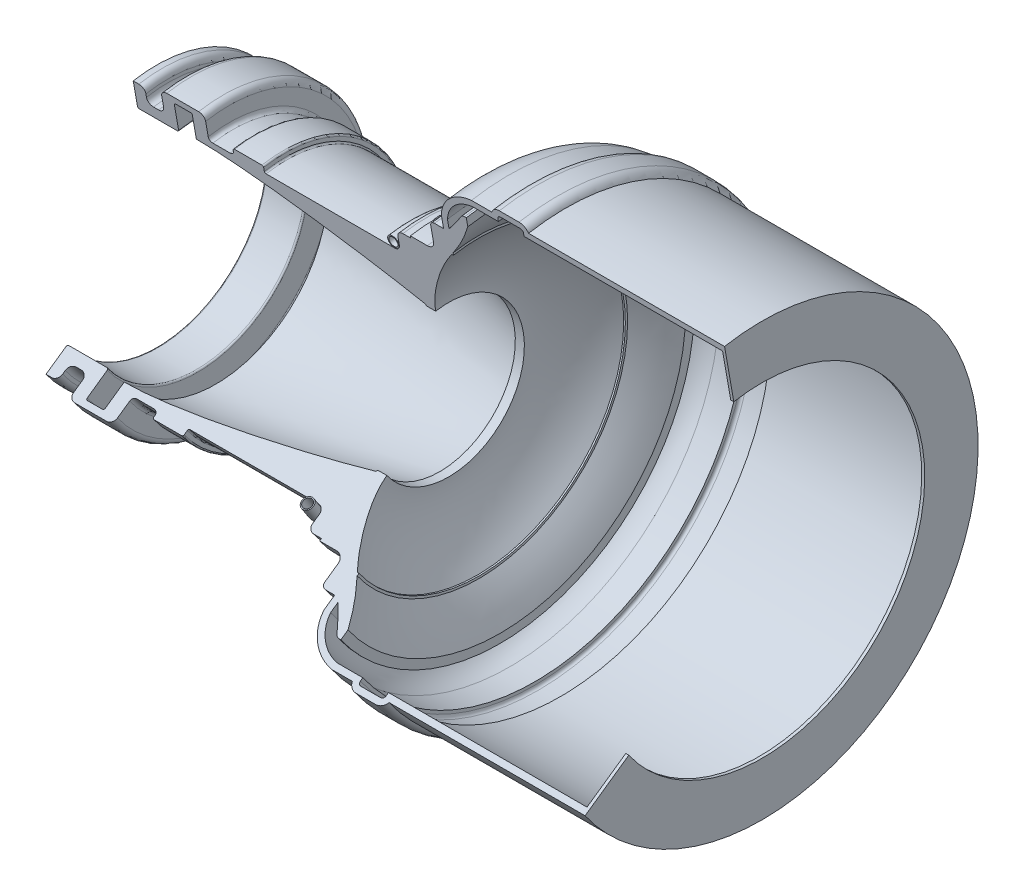
from build123d import *

# Parameters (mm, degrees)
REVOLVE1_ANGLE           = 100.00000000000021
REVOLVE1_OTHER_WAY_ANGLE = 145.0000000000003
REVOLVE2_ANGLE           = 235.00000000000054
REVOLVE2_OTHER_WAY_ANGLE = 10.000000000000021
REVOLVE3_ANGLE           = 10.000000000000021
REVOLVE3_OTHER_WAY_ANGLE = 235.00000000000054
REVOLVE4_OUTLINE_R       = 1.86
REVOLVE4_OUTLINE_R_2     = 1.5
REVOLVE4_ANGLE           = 250
BOSS_EXTRUDE1_DEPTH      = 2
FILLET1_R                = 0.5
CIRPATTERN2_COUNT        = 16
CIRPATTERN2_ANGLE        = 230.00000000000054
FILLET1_OF_CIRPATTERN2_R = 0.5


# Read off the part's stored shape, not the designer's step: Revolve4
with BuildPart() as part:
    # Sketch1 → Revolve1 (revolve)
    with BuildSketch(Plane(origin=(0, 0, 0), x_dir=(1, 0, 0), z_dir=(0, 1, 0))):
        with BuildLine():
            Line((20.819999999999997, 1.8200000000000005), (20.819999999999997, 22.199999999999996))
            Line((20.819999999999997, 22.199999999999996), (14.720000000000011, 22.199999999999996))
            ThreePointArc((14.720000000000011, 22.199999999999996), (13.305786437626903, 21.61421356237309), (12.719999999999999, 20.19999999999998))
            Line((12.719999999999999, 20.19999999999998), (12.719999999999997, 17.400000000000006))
            ThreePointArc((12.719999999999997, 17.400000000000006), (12.134213562373093, 15.985786437626896), (10.719999999999983, 15.399999999999993))
            Line((10.719999999999983, 15.399999999999993), (-31.78, 15.399999999999988))
            ThreePointArc((-31.78, 15.399999999999988), (-32.13355339059328, 15.546446609406715), (-32.28, 15.89999999999999))
            Line((-32.28, 15.89999999999999), (-32.28, 17.139999999999986))
            ThreePointArc((-32.28, 17.139999999999986), (-32.426446609406725, 17.493553390593263), (-32.78, 17.63999999999999))
            Line((-32.78, 17.63999999999999), (-41.88, 17.63999999999999))
            ThreePointArc((-41.88, 17.63999999999999), (-42.23355339059328, 17.493553390593263), (-42.38, 17.139999999999986))
            Line((-42.38, 17.139999999999986), (-42.38, 16.699999999999996))
            ThreePointArc((-42.38, 16.699999999999996), (-42.76076118445749, 15.780761184457473), (-43.680000000000014, 15.399999999999988))
            Line((-43.680000000000014, 15.399999999999988), (-49.419999999999995, 15.399999999999988))
            ThreePointArc((-49.419999999999995, 15.399999999999988), (-50.339238815542515, 15.780761184457477), (-50.72, 16.699999999999996))
            Line((-50.72, 16.699999999999996), (-50.72, 21.609999999999975))
            ThreePointArc((-50.72, 21.609999999999975), (-51.30578643762691, 23.024213562373088), (-52.72000000000002, 23.60999999999999))
            Line((-52.72000000000002, 23.60999999999999), (-63.26999999999998, 23.609999999999985))
            ThreePointArc((-63.26999999999998, 23.609999999999985), (-64.68421356237309, 23.02421356237308), (-65.27, 21.60999999999997))
            Line((-65.27, 21.60999999999997), (-65.27, 18.05))
            ThreePointArc((-65.27, 18.05), (-65.8557864376269, 16.63578643762689), (-67.27000000000001, 16.049999999999983))
            Line((-67.27000000000001, 16.049999999999983), (-68.94999999999999, 16.049999999999983))
            ThreePointArc((-68.94999999999999, 16.049999999999983), (-70.3642135623731, 16.635786437626887), (-70.95, 18.049999999999997))
            Line((-70.95, 18.049999999999997), (-70.95, 19.12999999999997))
            ThreePointArc((-70.95, 19.12999999999997), (-71.53578643762691, 20.54421356237308), (-72.95000000000002, 21.12999999999998))
            Line((-72.95000000000002, 21.12999999999998), (-74.81, 21.12999999999998))
            Line((-74.81, 21.12999999999998), (-74.81, 12.989999999999986))
            ThreePointArc((-74.81, 12.989999999999986), (-74.66355339059328, 12.63644660940671), (-74.31, 12.489999999999982))
            Line((-74.31, 12.489999999999982), (-61.67, 12.489999999999982))
            ThreePointArc((-61.67, 12.489999999999982), (-61.316446609406725, 12.63644660940671), (-61.17, 12.989999999999986))
            Line((-61.17, 12.989999999999986), (-61.17, 21.129999999999978))
            ThreePointArc((-61.17, 21.129999999999978), (-61.02355339059328, 21.483553390593254), (-60.67, 21.62999999999998))
            Line((-60.67, 21.62999999999998), (-55.71, 21.62999999999998))
            ThreePointArc((-55.71, 21.62999999999998), (-55.356446609406724, 21.483553390593254), (-55.21, 21.129999999999978))
            Line((-55.21, 21.129999999999978), (-55.21, 13.439999999999984))
            add(Edge.make_bspline(
                [(18.959999999999997, 1.8199999999999987), (0.2192284620746005, 6.529001303291011), (-36.5933333333334, 13.439999999999987), (-55.21, 13.439999999999984)],
                knots=[0, 0, 0, 0, 1, 1, 1, 1], degree=3))
            Line((18.959999999999997, 1.8199999999999987), (20.819999999999997, 1.8200000000000005))
        make_face()
    revolve(axis=Axis((-81.85554964444076, 0, 23.61), (1, 0, 0)), revolution_arc=REVOLVE1_ANGLE)

    # Sketch1 → Revolve1 other way (revolve)
    with BuildSketch(Plane(origin=(0, 0, 0), x_dir=(1, 0, 0), z_dir=(0, 1, 0))):
        with BuildLine():
            Line((20.819999999999997, 1.8200000000000005), (20.819999999999997, 22.199999999999996))
            Line((20.819999999999997, 22.199999999999996), (14.720000000000011, 22.199999999999996))
            ThreePointArc((14.720000000000011, 22.199999999999996), (13.305786437626903, 21.61421356237309), (12.719999999999999, 20.19999999999998))
            Line((12.719999999999999, 20.19999999999998), (12.719999999999997, 17.400000000000006))
            ThreePointArc((12.719999999999997, 17.400000000000006), (12.134213562373093, 15.985786437626896), (10.719999999999983, 15.399999999999993))
            Line((10.719999999999983, 15.399999999999993), (-31.78, 15.399999999999988))
            ThreePointArc((-31.78, 15.399999999999988), (-32.13355339059328, 15.546446609406715), (-32.28, 15.89999999999999))
            Line((-32.28, 15.89999999999999), (-32.28, 17.139999999999986))
            ThreePointArc((-32.28, 17.139999999999986), (-32.426446609406725, 17.493553390593263), (-32.78, 17.63999999999999))
            Line((-32.78, 17.63999999999999), (-41.88, 17.63999999999999))
            ThreePointArc((-41.88, 17.63999999999999), (-42.23355339059328, 17.493553390593263), (-42.38, 17.139999999999986))
            Line((-42.38, 17.139999999999986), (-42.38, 16.699999999999996))
            ThreePointArc((-42.38, 16.699999999999996), (-42.76076118445749, 15.780761184457473), (-43.680000000000014, 15.399999999999988))
            Line((-43.680000000000014, 15.399999999999988), (-49.419999999999995, 15.399999999999988))
            ThreePointArc((-49.419999999999995, 15.399999999999988), (-50.339238815542515, 15.780761184457477), (-50.72, 16.699999999999996))
            Line((-50.72, 16.699999999999996), (-50.72, 21.609999999999975))
            ThreePointArc((-50.72, 21.609999999999975), (-51.30578643762691, 23.024213562373088), (-52.72000000000002, 23.60999999999999))
            Line((-52.72000000000002, 23.60999999999999), (-63.26999999999998, 23.609999999999985))
            ThreePointArc((-63.26999999999998, 23.609999999999985), (-64.68421356237309, 23.02421356237308), (-65.27, 21.60999999999997))
            Line((-65.27, 21.60999999999997), (-65.27, 18.05))
            ThreePointArc((-65.27, 18.05), (-65.8557864376269, 16.63578643762689), (-67.27000000000001, 16.049999999999983))
            Line((-67.27000000000001, 16.049999999999983), (-68.94999999999999, 16.049999999999983))
            ThreePointArc((-68.94999999999999, 16.049999999999983), (-70.3642135623731, 16.635786437626887), (-70.95, 18.049999999999997))
            Line((-70.95, 18.049999999999997), (-70.95, 19.12999999999997))
            ThreePointArc((-70.95, 19.12999999999997), (-71.53578643762691, 20.54421356237308), (-72.95000000000002, 21.12999999999998))
            Line((-72.95000000000002, 21.12999999999998), (-74.81, 21.12999999999998))
            Line((-74.81, 21.12999999999998), (-74.81, 12.989999999999986))
            ThreePointArc((-74.81, 12.989999999999986), (-74.66355339059328, 12.63644660940671), (-74.31, 12.489999999999982))
            Line((-74.31, 12.489999999999982), (-61.67, 12.489999999999982))
            ThreePointArc((-61.67, 12.489999999999982), (-61.316446609406725, 12.63644660940671), (-61.17, 12.989999999999986))
            Line((-61.17, 12.989999999999986), (-61.17, 21.129999999999978))
            ThreePointArc((-61.17, 21.129999999999978), (-61.02355339059328, 21.483553390593254), (-60.67, 21.62999999999998))
            Line((-60.67, 21.62999999999998), (-55.71, 21.62999999999998))
            ThreePointArc((-55.71, 21.62999999999998), (-55.356446609406724, 21.483553390593254), (-55.21, 21.129999999999978))
            Line((-55.21, 21.129999999999978), (-55.21, 13.439999999999984))
            add(Edge.make_bspline(
                [(18.959999999999997, 1.8199999999999987), (0.2192284620746005, 6.529001303291011), (-36.5933333333334, 13.439999999999987), (-55.21, 13.439999999999984)],
                knots=[0, 0, 0, 0, 1, 1, 1, 1], degree=3))
            Line((18.959999999999997, 1.8199999999999987), (20.819999999999997, 1.8200000000000005))
        make_face()
    revolve(axis=Axis((-81.85554964444076, 0, 23.61), (-1, 0, 0)), revolution_arc=REVOLVE1_OTHER_WAY_ANGLE)

    # Sketch6 → Revolve2 (revolve)
    with BuildSketch(Plane.XY.offset(23.61)):
        with BuildLine():
            Line((21.96, 25.04366115910043), (18.96, 25.04366115910043))
            Line((18.96, 25.04366115910043), (17.302934675950663, 28.295834972387976))
            Line((17.302934675950663, 28.295834972387976), (17.302934675950667, 46.52583471304439))
            Line((17.302934675950667, 46.52583471304439), (22.932934523411976, 46.52583471304439))
            ThreePointArc((22.932934523411976, 46.52583471304439), (24.70070147637834, 47.25806776007802), (25.432934523411973, 49.02583471304439))
            Line((25.432934523411973, 49.02583471304439), (25.432934523411973, 54.39583471304439))
            ThreePointArc((25.432934523411973, 54.39583471304439), (25.872274351632154, 55.45649488482421), (26.932934523411976, 55.89583471304439))
            Line((26.932934523411976, 55.89583471304439), (29.432934523411973, 55.89583471304439))
            add(Edge.make_bspline(
                [(29.432934523411973, 55.89583471304439), (31.666267856745318, 55.89583471304439), (34.103147145509276, 59.98879442341514), (36.24592726134377, 62.32337660056277), (37.05996232845516, 63.650236811973734)],
                knots=[0, 0, 0, 0, 0.5723179017660327, 0.930416882946525, 0.930416882946525, 0.930416882946525, 0.930416882946525], degree=3))
            ThreePointArc((37.05996232845516, 63.650236811973734), (37.605924376777864, 64.17476617580208), (38.33852141867947, 64.36583471304438))
            Line((38.33852141867947, 64.36583471304438), (38.932934523411966, 64.36583471304438))
            Line((38.932934523411966, 64.36583471304438), (38.93293452341197, 61.46583471304439))
            add(Edge.make_bspline(
                [(38.93293452341197, 61.46583471304439), (35.1803646122963, 52.64413437580968), (28.54263893787043, 46.69825995929512), (21.960000000000004, 31.193661159100422), (21.96, 25.04366115910043)],
                knots=[0, 0, 0, 0, 0.468719812917794, 1, 1, 1, 1], degree=3))
        make_face()
    revolve(axis=Axis((0, 0, 23.61), (-1, 0, 0)), revolution_arc=REVOLVE2_ANGLE)

    # Sketch6 → Revolve2 other way (revolve)
    with BuildSketch(Plane.XY.offset(23.61)):
        with BuildLine():
            Line((21.96, 25.04366115910043), (18.96, 25.04366115910043))
            Line((18.96, 25.04366115910043), (17.302934675950663, 28.295834972387976))
            Line((17.302934675950663, 28.295834972387976), (17.302934675950667, 46.52583471304439))
            Line((17.302934675950667, 46.52583471304439), (22.932934523411976, 46.52583471304439))
            ThreePointArc((22.932934523411976, 46.52583471304439), (24.70070147637834, 47.25806776007802), (25.432934523411973, 49.02583471304439))
            Line((25.432934523411973, 49.02583471304439), (25.432934523411973, 54.39583471304439))
            ThreePointArc((25.432934523411973, 54.39583471304439), (25.872274351632154, 55.45649488482421), (26.932934523411976, 55.89583471304439))
            Line((26.932934523411976, 55.89583471304439), (29.432934523411973, 55.89583471304439))
            add(Edge.make_bspline(
                [(29.432934523411973, 55.89583471304439), (31.666267856745318, 55.89583471304439), (34.103147145509276, 59.98879442341514), (36.24592726134377, 62.32337660056277), (37.05996232845516, 63.650236811973734)],
                knots=[0, 0, 0, 0, 0.5723179017660327, 0.930416882946525, 0.930416882946525, 0.930416882946525, 0.930416882946525], degree=3))
            ThreePointArc((37.05996232845516, 63.650236811973734), (37.605924376777864, 64.17476617580208), (38.33852141867947, 64.36583471304438))
            Line((38.33852141867947, 64.36583471304438), (38.932934523411966, 64.36583471304438))
            Line((38.932934523411966, 64.36583471304438), (38.93293452341197, 61.46583471304439))
            add(Edge.make_bspline(
                [(38.93293452341197, 61.46583471304439), (35.1803646122963, 52.64413437580968), (28.54263893787043, 46.69825995929512), (21.960000000000004, 31.193661159100422), (21.96, 25.04366115910043)],
                knots=[0, 0, 0, 0, 0.468719812917794, 1, 1, 1, 1], degree=3))
        make_face()
    revolve(axis=Axis((0, 0, 23.61), (1, 0, 0)), revolution_arc=REVOLVE2_OTHER_WAY_ANGLE)

    # Sketch9 → Revolve3 (revolve)
    with BuildSketch(Plane.XY.offset(23.61)):
        with BuildLine():
            Line((31.944174248302648, 48.5), (31.944174248302648, 60))
            ThreePointArc((31.944174248302648, 60), (35.46409174701751, 66.38963205418065), (42.03417424830265, 69.56))
            Line((42.03417424830265, 69.56), (50.47417424830265, 69.56))
            Line((50.47417424830265, 69.56), (50.47417424830265, 70.56000000000002))
            ThreePointArc((50.47417424830265, 70.56000000000002), (50.76706746711611, 71.26710678118657), (51.47417424830265, 71.56000000000002))
            Line((51.47417424830265, 71.56000000000002), (57.97417424830265, 71.56000000000002))
            ThreePointArc((57.97417424830265, 71.56000000000002), (58.6812810294892, 71.26710678118657), (58.974174248302646, 70.56000000000002))
            Line((58.974174248302646, 70.56000000000002), (58.97417424830266, 69.56))
            Line((58.97417424830266, 69.56), (124.72417424830266, 69.56))
            Line((124.72417424830266, 69.56), (124.72417424830263, 53.88999999999999))
            Line((124.72417424830263, 53.88999999999999), (125.72417424830262, 53.89))
            Line((125.72417424830262, 53.89), (125.72417424830262, 71.56))
            Line((125.72417424830262, 71.56), (60.802601373048844, 71.56))
            ThreePointArc((60.802601373048844, 71.56), (59.706225055871535, 73.00948974278319), (57.97417424830265, 73.56000000000002))
            Line((57.97417424830265, 73.56000000000002), (51.47417424830265, 73.56000000000002))
            ThreePointArc((51.47417424830265, 73.56000000000002), (49.74212344073377, 73.00948974278319), (48.64574712355646, 71.56))
            Line((48.64574712355646, 71.56), (41.89865471715389, 71.56))
            ThreePointArc((41.89865471715389, 71.56), (34.068084474765875, 67.82205812783253), (29.944174248302645, 60.187701298030326))
            Line((29.944174248302645, 60.187701298030326), (29.944174248302645, 48.5))
            Line((29.944174248302645, 48.5), (31.944174248302648, 48.5))
        make_face()
    revolve(axis=Axis((0, 0, 23.61), (1, 0, 0)), revolution_arc=REVOLVE3_ANGLE)

    # Sketch9 → Revolve3 other way (revolve)
    with BuildSketch(Plane.XY.offset(23.61)):
        with BuildLine():
            Line((31.944174248302648, 48.5), (31.944174248302648, 60))
            ThreePointArc((31.944174248302648, 60), (35.46409174701751, 66.38963205418065), (42.03417424830265, 69.56))
            Line((42.03417424830265, 69.56), (50.47417424830265, 69.56))
            Line((50.47417424830265, 69.56), (50.47417424830265, 70.56000000000002))
            ThreePointArc((50.47417424830265, 70.56000000000002), (50.76706746711611, 71.26710678118657), (51.47417424830265, 71.56000000000002))
            Line((51.47417424830265, 71.56000000000002), (57.97417424830265, 71.56000000000002))
            ThreePointArc((57.97417424830265, 71.56000000000002), (58.6812810294892, 71.26710678118657), (58.974174248302646, 70.56000000000002))
            Line((58.974174248302646, 70.56000000000002), (58.97417424830266, 69.56))
            Line((58.97417424830266, 69.56), (124.72417424830266, 69.56))
            Line((124.72417424830266, 69.56), (124.72417424830263, 53.88999999999999))
            Line((124.72417424830263, 53.88999999999999), (125.72417424830262, 53.89))
            Line((125.72417424830262, 53.89), (125.72417424830262, 71.56))
            Line((125.72417424830262, 71.56), (60.802601373048844, 71.56))
            ThreePointArc((60.802601373048844, 71.56), (59.706225055871535, 73.00948974278319), (57.97417424830265, 73.56000000000002))
            Line((57.97417424830265, 73.56000000000002), (51.47417424830265, 73.56000000000002))
            ThreePointArc((51.47417424830265, 73.56000000000002), (49.74212344073377, 73.00948974278319), (48.64574712355646, 71.56))
            Line((48.64574712355646, 71.56), (41.89865471715389, 71.56))
            ThreePointArc((41.89865471715389, 71.56), (34.068084474765875, 67.82205812783253), (29.944174248302645, 60.187701298030326))
            Line((29.944174248302645, 60.187701298030326), (29.944174248302645, 48.5))
            Line((29.944174248302645, 48.5), (31.944174248302648, 48.5))
        make_face()
    revolve(axis=Axis((0, 0, 23.61), (-1, 0, 0)), revolution_arc=REVOLVE3_OTHER_WAY_ANGLE)

    # Sketch14 → Boss-Extrude1 (add)
    with BuildSketch(Plane.ZY.offset(-25.432934523411976)):
        with BuildLine():
            Line((29.853725294066894, 49.58058335980471), (31.053068326126613, 51.172367158577714))
            ThreePointArc((31.053068326125697, 51.17236715857906), (29.089664429820402, 51.419682072688445), (27.11823550090517, 51.59169226135138))
            Line((27.118235500905097, 51.59169226135132), (27.868618139340267, 49.82420106083059))
            Line((27.868618139340267, 49.82420106083059), (29.853725294066894, 49.58058335980471))
        make_face()
        with BuildLine():
            Line((31.053068326126613, 51.172367158577714), (31.057257989330186, 51.17792773451929))
            Line((31.057257989330186, 51.17792773451929), (30.275683529866846, 53.018889810259736))
            Line((30.275683529866846, 53.018889810259736), (28.290576375140216, 53.26250751128561))
            Line((28.290576375140216, 53.26250751128561), (27.08704367987692, 51.665163136571046))
            Line((27.08704367987692, 51.665163136571046), (27.118235500905097, 51.59169226135132))
            ThreePointArc((27.11823550090517, 51.59169226135138), (29.089664429820402, 51.419682072688445), (31.053068326125697, 51.17236715857906))
        make_face()
    boss_extrude1 = extrude(amount=BOSS_EXTRUDE1_DEPTH)

    # Fillet1
    fillet1_edges = [part.edges().sort_by_distance(p)[0] for p in [
        (23.432934523411976, 50.379255547162, 30.45549164169854),
        (23.432934523411976, 52.09840877238951, 30.666470759598518),
        (23.432934523411976, 53.14069866077267, 29.28312995250353),
        (23.432934523411976, 52.46383532392833, 27.688810027508566),
        (23.432934523411976, 50.74468209870082, 27.477830909608592),
        (23.432934523411976, 49.702392210317655, 28.86117171670358),
    ]]
    fillet(fillet1_edges, radius=FILLET1_R)

    # CirPattern2: Boss-Extrude1 ×16 about axis
    cirpattern2_axis = Axis((0, -1.51e-15, 23.609999999999996), (-1, 0, 0))
    for i in range(1, CIRPATTERN2_COUNT):
        add(boss_extrude1.rotate(cirpattern2_axis, i * CIRPATTERN2_ANGLE / (CIRPATTERN2_COUNT - 1)))

    # Fillet1 of CirPattern2
    fillet1_of_cirpattern2_edges = [part.edges().sort_by_distance(p)[0] for p in [
        (23.432934523411976, 50.39612431989454, 16.889821517507738),
        (23.432934523411976, 52.10987220638384, 16.638687725370033),
        (23.432934523411976, 52.749257905888506, 15.02897162391956),
        (23.432934523411976, 51.67489571890389, 13.670389314606787),
        (23.432934523411976, 49.96114783241459, 13.921523106744491),
        (23.432934523411976, 49.32176213290991, 15.531239208194968),
        (23.432934523411976, 46.825166015645436, 3.8025778327905186),
        (23.432934523411976, 48.41150253310663, 3.1072099780768454),
        (23.432934523411976, 48.60246456468009, 1.3857183276476803),
        (23.432934523411976, 47.20709007879236, 0.3595945319321885),
        (23.432934523411976, 45.62075356133118, 1.0549623866458617),
        (23.432934523411976, 45.42979152975771, 2.7764540370750304),
        (23.432934523411976, 39.92060615408823, -7.874525557692479),
        (23.432934523411976, 41.266596008639894, -8.96462248523791),
        (23.432934523411976, 40.99553930407401, -10.67533235628849),
        (23.432934523411976, 39.37849274495647, -11.295945299793637),
        (23.432934523411976, 38.03250289040481, -10.205848372248202),
        (23.432934523411976, 38.303559594970686, -8.495138501197616),
        (23.432934523411976, 30.173997749670825, -17.310166239956537),
        (23.432934523411976, 31.1838165319824, -18.717385493268097),
        (23.432934523411976, 30.470038301075803, -20.29552383862437),
        (23.432934523411976, 28.746441287857635, -20.466442930669082),
        (23.432934523411976, 27.736622505546052, -19.059223677357522),
        (23.432934523411976, 28.45040073645265, -17.481085332001243),
        (23.432934523411976, 18.279226413916355, -23.832597178185782),
        (23.432934523411976, 18.8809825803639, -25.4567552727512),
        (23.432934523411976, 17.775298493931885, -26.789970447061403),
        (23.432934523411976, 16.067858241052335, -26.499027526806206),
        (23.432934523411976, 15.466102074604798, -24.87486943224079),
        (23.432934523411976, 16.571786161036812, -23.541654257930578),
        (23.432934523411976, 5.0831108903065925, -26.977470078861085),
        (23.432934523411976, 5.233963903113484, -28.702939107423195),
        (23.432934523411976, 3.815090397338878, -29.696316163032424),
        (23.432934523411976, 2.2453638787573844, -28.964224190079566),
        (23.432934523411976, 2.0945108659504967, -27.23875516151745),
        (23.432934523411976, 3.5133843717251025, -26.245378105908205),
        (23.432934523411976, -8.47488410585504, -26.520893515826586),
        (23.432934523411976, -8.785673852785438, -28.22483299045676),
        (23.432934523411976, -10.416723597791474, -28.807650911694374),
        (23.432934523411976, -11.736983595867114, -27.686529358301826),
        (23.432934523411976, -11.426193848936713, -25.982589883671665),
        (23.432934523411976, -9.795144103930674, -25.399771962434038),
        (23.432934523411973, -21.429530747761103, -22.495372325072708),
        (23.432934523411973, -22.17983734922609, -24.056474501036227),
        (23.432934523411973, -23.90694479224617, -24.18724101152214),
        (23.432934523411973, -24.883745633801247, -22.75690534604452),
        (23.432934523411973, -24.133439032336256, -21.195803170081),
        (23.432934523411973, -22.40633158931618, -21.065036659595087),
        (23.432934523411976, -32.858555098242725, -15.187493503557235),
        (23.432934523411976, -33.99496233668386, -16.494619583328657),
        (23.432934523411976, -35.69517034693564, -16.16402508567981),
        (23.432934523411976, -36.258971118746274, -14.526304508259557),
        (23.432934523411976, -35.122563880305144, -13.219178428488142),
        (23.432934523411976, -33.422355870053366, -13.549772926136981),
        (23.432934523411976, -41.94829611527504, -5.117523358758561),
        (23.432934523411976, -43.38990029590269, -6.077615743061699),
        (23.432934523411976, -44.942166781002996, -5.309196092587868),
        (23.432934523411976, -45.052829085475665, -3.580684057810899),
        (23.432934523411976, -43.61122490484803, -2.620591673507775),
        (23.432934523411976, -42.058958419747704, -3.3890113239815918),
        (23.432934523411976, -48.051632231797704, 6.997631560705173),
        (23.432934523411976, -49.69580192048185, 6.452924267920956),
        (23.432934523411976, -50.98961711800169, 7.60446334006167),
        (23.432934523411976, -50.63926262683739, 9.300709704986595),
        (23.432934523411976, -48.995092938153256, 9.845416997770805),
        (23.432934523411976, -47.70127774063341, 8.693877925630098),
        (23.432934523411976, -50.734051570671454, 20.29546284871198),
        (23.432934523411976, -52.46373418434499, 20.204919732157162),
        (23.432934523411976, -53.406988130256046, 21.657597257805307),
        (23.432934523411976, -52.62055946249357, 23.20081790000827),
        (23.432934523411976, -50.89087684882003, 23.29136101656309),
        (23.432934523411976, -49.94762290290897, 21.838683490914946),
        (23.432934523411976, -49.80458594008175, 33.829264388390655),
        (23.432934523411976, -51.496641015074715, 34.19933144068061),
        (23.432934523411976, -52.02218108418446, 35.84972764637187),
        (23.432934523411976, -50.85566607830126, 37.13005679977318),
        (23.432934523411976, -49.163611003308304, 36.75998974748323),
        (23.432934523411976, -48.63807093419855, 35.109593541791966),
        (23.432934523411976, -45.32940634031003, 46.63553074606271),
        (23.432934523411976, -46.86337221224383, 47.439861961261016),
        (23.432934523411976, -46.933783882792184, 49.170480982493174),
        (23.432934523411976, -45.47022968140675, 50.09676878852706),
        (23.432934523411976, -43.93626380947295, 49.292437573328755),
        (23.432934523411976, -43.865852138924595, 47.56181855209658),
        (23.432934523411976, -37.627112083487845, 57.802551550878164),
        (23.432934523411976, -38.893781856698155, 58.98388456304507),
        (23.432934523411976, -38.504052344437554, 60.671519270934525),
        (23.432934523411976, -36.847653058966664, 61.177820966657066),
        (23.432934523411976, -35.58098328575636, 59.99648795449015),
        (23.432934523411976, -35.970712798016955, 58.30885324660069),
    ]]
    fillet(fillet1_of_cirpattern2_edges, radius=FILLET1_OF_CIRPATTERN2_R)


with BuildPart() as body_2:
    # Revolve4 outline → Revolve4 (revolve)
    with BuildSketch(Plane(origin=(0, 0, 23.61), x_dir=(0, -0.4999999999999904, 0.8660254037844441), z_dir=(0, 0.8660254037844441, 0.4999999999999904))):
        with Locations((41.01, 10.72)):
            Circle(REVOLVE4_OUTLINE_R)
        with Locations((41.01, 10.72)):
            Circle(REVOLVE4_OUTLINE_R_2, mode=Mode.SUBTRACT)
    revolve(axis=Axis((0, 0, 23.61), (1, 0, 0)), revolution_arc=REVOLVE4_ANGLE)


solid = Compound([part.part, body_2.part])
